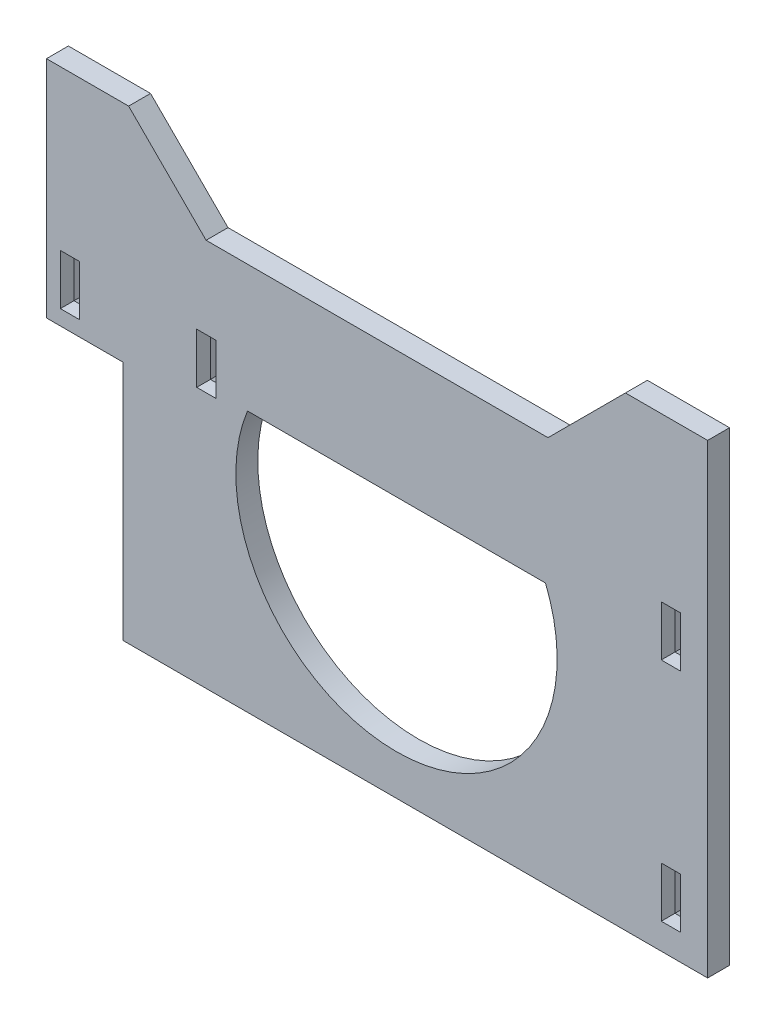
from build123d import *
from OCP.BRepFilletAPI import BRepFilletAPI_MakeChamfer

# Parameters (mm, degrees)
SKETCH1_W           = 3.53
SKETCH1_H           = 9.2
BOSS_EXTRUDE1_DEPTH = 4
BOSS_EXTRUDE2_DEPTH = 4
CHAMFER1_SIZE       = 1.5
CHAMFER1_SIZE2      = 0.5


with BuildPart() as part:
    # Sketch1 → Boss-Extrude1 (new body)
    with BuildSketch(Plane.XY):
        Polygon((52.4925, 30), (52.4925, -30), (-54.2075, -30), (-54.2075, 14), (-68.2075, 14), (-68.2075, 30), align=None)
        with BuildLine():
            Line((-31.510630119, 17.647843267), (22.89855475, 17.647843267))
            ThreePointArc((22.89855475, 17.647843267), (-4.306037684, -22.627990687), (-31.510630119, 17.647843267))
        make_face(mode=Mode.SUBTRACT)
        with Locations((-39.0075, 21.35)):
            Rectangle(SKETCH1_W, SKETCH1_H, mode=Mode.SUBTRACT)
        with Locations((45.7925, 20.65)):
            Rectangle(SKETCH1_W, SKETCH1_H, mode=Mode.SUBTRACT)
        with Locations((45.8, -20.65)):
            Rectangle(SKETCH1_W, SKETCH1_H, mode=Mode.SUBTRACT)
        with Locations((-63.9075, 21.35)):
            Rectangle(SKETCH1_W, SKETCH1_H, mode=Mode.SUBTRACT)
    extrude(amount=BOSS_EXTRUDE1_DEPTH)

    # Sketch2 → Boss-Extrude2 (add)
    with BuildSketch(Plane.XY):
        Polygon((-68.2075, 30), (52.4925, 30), (52.4925, 55), (37.4925, 55), (23.350364376, 40.857864376), (-39.065364376, 40.857864376), (-53.2075, 55), (-68.2075, 55), align=None)
    extrude(amount=BOSS_EXTRUDE2_DEPTH)

    # Chamfer1: one chamfer whose edges measure the first distance from different faces: ONE call of the kernel's chamfer builder (chamfer() names one face for all edges)
    chamfer1_edges_1 = [part.edges().sort_by_distance(p)[0] for p in [
        (45.8, -25.25, 0),
    ]]
    chamfer1_side_1 = [part.faces().sort_by_distance(p)[0] for p in [
        (45.8, -25.25, 2),
    ]]
    chamfer1_edges_2 = [part.edges().sort_by_distance(p)[0] for p in [
        (44.035, -20.65, 0),
    ]]
    chamfer1_side_2 = [part.faces().sort_by_distance(p)[0] for p in [
        (44.035, -20.65, 2),
    ]]
    chamfer1_edges_3 = [part.edges().sort_by_distance(p)[0] for p in [
        (45.8, -16.05, 0),
    ]]
    chamfer1_side_3 = [part.faces().sort_by_distance(p)[0] for p in [
        (45.8, -16.05, 2),
    ]]
    chamfer1_edges_4 = [part.edges().sort_by_distance(p)[0] for p in [
        (47.565, -20.65, 0),
    ]]
    chamfer1_side_4 = [part.faces().sort_by_distance(p)[0] for p in [
        (47.565, -20.65, 2),
    ]]
    chamfer1_edges_5 = [part.edges().sort_by_distance(p)[0] for p in [
        (-63.9075, 25.95, 0),
    ]]
    chamfer1_side_5 = [part.faces().sort_by_distance(p)[0] for p in [
        (-63.9075, 25.95, 2),
    ]]
    chamfer1_edges_6 = [part.edges().sort_by_distance(p)[0] for p in [
        (-62.1425, 21.35, 0),
    ]]
    chamfer1_side_6 = [part.faces().sort_by_distance(p)[0] for p in [
        (-62.1425, 21.35, 2),
    ]]
    chamfer1_edges_7 = [part.edges().sort_by_distance(p)[0] for p in [
        (-63.9075, 16.75, 0),
    ]]
    chamfer1_side_7 = [part.faces().sort_by_distance(p)[0] for p in [
        (-63.9075, 16.75, 2),
    ]]
    chamfer1_edges_8 = [part.edges().sort_by_distance(p)[0] for p in [
        (-65.6725, 21.35, 0),
    ]]
    chamfer1_side_8 = [part.faces().sort_by_distance(p)[0] for p in [
        (-65.6725, 21.35, 2),
    ]]
    chamfer1_edges_9 = [part.edges().sort_by_distance(p)[0] for p in [
        (-39.0075, 25.95, 0),
    ]]
    chamfer1_side_9 = [part.faces().sort_by_distance(p)[0] for p in [
        (-39.0075, 25.95, 2),
    ]]
    chamfer1_edges_10 = [part.edges().sort_by_distance(p)[0] for p in [
        (-37.2425, 21.35, 0),
    ]]
    chamfer1_side_10 = [part.faces().sort_by_distance(p)[0] for p in [
        (-37.2425, 21.35, 2),
    ]]
    chamfer1_edges_11 = [part.edges().sort_by_distance(p)[0] for p in [
        (-39.0075, 16.75, 0),
    ]]
    chamfer1_side_11 = [part.faces().sort_by_distance(p)[0] for p in [
        (-39.0075, 16.75, 2),
    ]]
    chamfer1_edges_12 = [part.edges().sort_by_distance(p)[0] for p in [
        (-40.7725, 21.35, 0),
    ]]
    chamfer1_side_12 = [part.faces().sort_by_distance(p)[0] for p in [
        (-40.7725, 21.35, 2),
    ]]
    chamfer1_edges_13 = [part.edges().sort_by_distance(p)[0] for p in [
        (45.7925, 25.25, 0),
    ]]
    chamfer1_side_13 = [part.faces().sort_by_distance(p)[0] for p in [
        (45.7925, 25.25, 2),
    ]]
    chamfer1_edges_14 = [part.edges().sort_by_distance(p)[0] for p in [
        (47.5575, 20.65, 0),
    ]]
    chamfer1_side_14 = [part.faces().sort_by_distance(p)[0] for p in [
        (47.5575, 20.65, 2),
    ]]
    chamfer1_edges_15 = [part.edges().sort_by_distance(p)[0] for p in [
        (45.7925, 16.05, 0),
    ]]
    chamfer1_side_15 = [part.faces().sort_by_distance(p)[0] for p in [
        (45.7925, 16.05, 2),
    ]]
    chamfer1_edges_16 = [part.edges().sort_by_distance(p)[0] for p in [
        (44.0275, 20.65, 0),
    ]]
    chamfer1_side_16 = [part.faces().sort_by_distance(p)[0] for p in [
        (44.0275, 20.65, 2),
    ]]
    chamfer1 = BRepFilletAPI_MakeChamfer(part.part.solid().wrapped)
    for e in chamfer1_edges_1:
        chamfer1.Add(CHAMFER1_SIZE, CHAMFER1_SIZE2, e.wrapped, chamfer1_side_1[0].wrapped)  # the first distance lies on this face
    for e in chamfer1_edges_2:
        chamfer1.Add(CHAMFER1_SIZE, CHAMFER1_SIZE2, e.wrapped, chamfer1_side_2[0].wrapped)  # the first distance lies on this face
    for e in chamfer1_edges_3:
        chamfer1.Add(CHAMFER1_SIZE, CHAMFER1_SIZE2, e.wrapped, chamfer1_side_3[0].wrapped)  # the first distance lies on this face
    for e in chamfer1_edges_4:
        chamfer1.Add(CHAMFER1_SIZE, CHAMFER1_SIZE2, e.wrapped, chamfer1_side_4[0].wrapped)  # the first distance lies on this face
    for e in chamfer1_edges_5:
        chamfer1.Add(CHAMFER1_SIZE, CHAMFER1_SIZE2, e.wrapped, chamfer1_side_5[0].wrapped)  # the first distance lies on this face
    for e in chamfer1_edges_6:
        chamfer1.Add(CHAMFER1_SIZE, CHAMFER1_SIZE2, e.wrapped, chamfer1_side_6[0].wrapped)  # the first distance lies on this face
    for e in chamfer1_edges_7:
        chamfer1.Add(CHAMFER1_SIZE, CHAMFER1_SIZE2, e.wrapped, chamfer1_side_7[0].wrapped)  # the first distance lies on this face
    for e in chamfer1_edges_8:
        chamfer1.Add(CHAMFER1_SIZE, CHAMFER1_SIZE2, e.wrapped, chamfer1_side_8[0].wrapped)  # the first distance lies on this face
    for e in chamfer1_edges_9:
        chamfer1.Add(CHAMFER1_SIZE, CHAMFER1_SIZE2, e.wrapped, chamfer1_side_9[0].wrapped)  # the first distance lies on this face
    for e in chamfer1_edges_10:
        chamfer1.Add(CHAMFER1_SIZE, CHAMFER1_SIZE2, e.wrapped, chamfer1_side_10[0].wrapped)  # the first distance lies on this face
    for e in chamfer1_edges_11:
        chamfer1.Add(CHAMFER1_SIZE, CHAMFER1_SIZE2, e.wrapped, chamfer1_side_11[0].wrapped)  # the first distance lies on this face
    for e in chamfer1_edges_12:
        chamfer1.Add(CHAMFER1_SIZE, CHAMFER1_SIZE2, e.wrapped, chamfer1_side_12[0].wrapped)  # the first distance lies on this face
    for e in chamfer1_edges_13:
        chamfer1.Add(CHAMFER1_SIZE, CHAMFER1_SIZE2, e.wrapped, chamfer1_side_13[0].wrapped)  # the first distance lies on this face
    for e in chamfer1_edges_14:
        chamfer1.Add(CHAMFER1_SIZE, CHAMFER1_SIZE2, e.wrapped, chamfer1_side_14[0].wrapped)  # the first distance lies on this face
    for e in chamfer1_edges_15:
        chamfer1.Add(CHAMFER1_SIZE, CHAMFER1_SIZE2, e.wrapped, chamfer1_side_15[0].wrapped)  # the first distance lies on this face
    for e in chamfer1_edges_16:
        chamfer1.Add(CHAMFER1_SIZE, CHAMFER1_SIZE2, e.wrapped, chamfer1_side_16[0].wrapped)  # the first distance lies on this face
    add(Compound.cast(chamfer1.Shape()), mode=Mode.REPLACE)


solid = part.part
